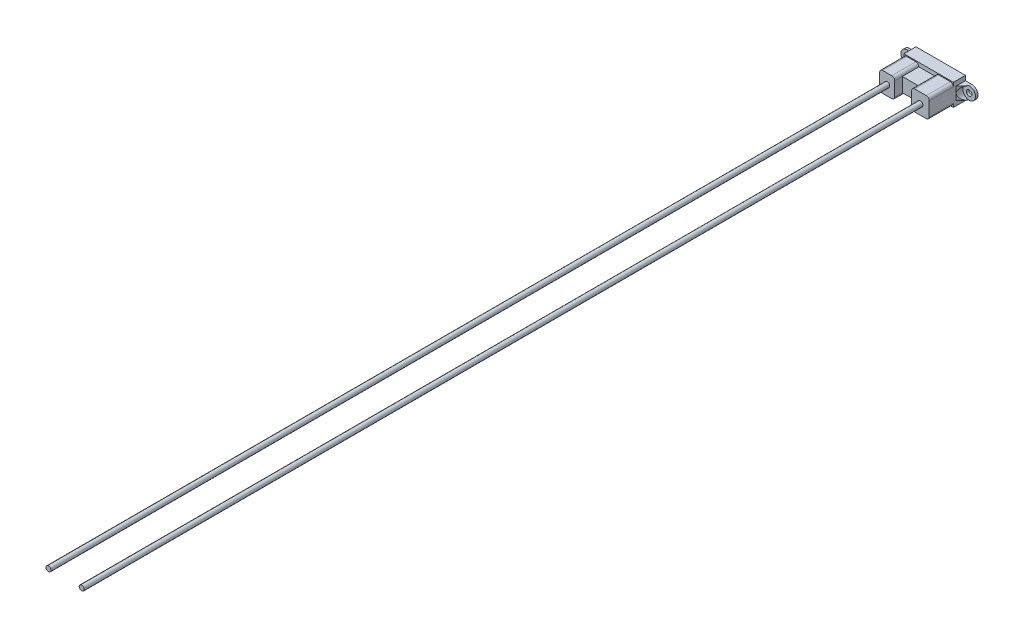
from build123d import *

# Parameters (mm, degrees)
EXTRUDE_1_DEPTH     = 7.2
SKETCH_2_R          = 1.6
EXTRUDE_2_DEPTH     = 1.5
EXTRUDE_START       = -7.5
EXTRUDE_3_DEPTH     = 7.5
EXTRUDE_4_DEPTH     = 10.1
SKETCH_7_R          = 3.75
CUT_EXTRUDE_3_DEPTH = 21.5
SKETCH_8_W          = 10.45
SKETCH_8_H          = 11.9
EXTRUDE_5_DEPTH     = 14.4
FILLET_1_R          = 1.75
EXTRUDE_6_DEPTH     = 9.9
SKETCH_10_W         = 8.1
SKETCH_10_H         = 8.2
EXTRUDE_7_DEPTH     = 5
SKETCH_11_W         = 7.7
SKETCH_11_H         = 4.6
CUT_EXTRUDE_4_DEPTH = 8.2
SKETCH_13_R         = 1.5
EXTRUDE_9_DEPTH     = 500


with BuildPart() as part:
    # 草图1 → 凸台-拉伸1 (new body)
    with BuildSketch(Plane.XY):
        Polygon((14.75, -6.5), (4.675, -6.5), (4.675, -4.2), (-5.425, -4.2), (-5.425, -6.5), (-14.75, -6.5), (-14.75, 6.5), (14.75, 6.5), align=None)
    extrude(amount=EXTRUDE_1_DEPTH)

    # 草图2 → 凸台-拉伸2 (add)
    # profile 1 of 2: a face of its own
    with BuildSketch(Plane.XY):
        with BuildLine():
            Line((-18.5, 3.75), (-14.75, 3.75))
            Line((-14.75, 3.75), (-14.75, -3.75))
            Line((-14.75, -3.75), (-18.5, -3.75))
            ThreePointArc((-18.5, -3.75), (-22.25, 0), (-18.5, 3.75))
        make_face()
        with Locations((-18.5, 0)):
            Circle(SKETCH_2_R, mode=Mode.SUBTRACT)
    # profile 2 of 2: a face of its own
    with BuildSketch(Plane.XY):
        with BuildLine():
            Line((18.5, 3.75), (14.75, 3.75))
            Line((14.75, 3.75), (14.75, 0))
            Line((14.75, 0), (14.75, -3.75))
            Line((14.75, -3.75), (18.5, -3.75))
            ThreePointArc((18.5, -3.75), (22.25, 0), (18.5, 3.75))
        make_face()
        with Locations((18.5, 0)):
            Circle(SKETCH_2_R, mode=Mode.SUBTRACT)
    extrude(amount=EXTRUDE_2_DEPTH)

    # 草图3 → 凸台-拉伸3 (add)
    with BuildSketch(Plane(origin=(0, 3.75, 0), x_dir=(1, 0, 0), z_dir=(0, 1, 0)).offset(EXTRUDE_START)):
        Polygon((-14.75, -1.5), (-14.75, -5.5), (-17.578427125, -2.671572875), (-18.012250402, -1.5), align=None)
    extrude_3 = extrude(amount=EXTRUDE_3_DEPTH)

    # 草图5 → 凸台-拉伸4 (add)
    with BuildSketch(Plane(origin=(-5.425, 0, 0), x_dir=(0, 0, -1), z_dir=(1, 0, 0))):
        Polygon((-3.9, -4.2), (-2.7, -4.2), (-2.7, -6.5), (-2.7, -12.4), (-3.9, -12.4), align=None)
    extrude(amount=EXTRUDE_4_DEPTH)

    # 草图7 → 切除-拉伸3 (cut)
    with BuildSketch(Plane.XY.offset(1.5)):
        with Locations((-18.5, 0)):
            Circle(SKETCH_7_R)
        with BuildLine():
            Line((-18.012250402, 1.523843932), (-18.012250402, -1.523843932))
            ThreePointArc((-18.012250402, -1.523843932), (-20.1, 0), (-18.012250402, 1.523843932))
        make_face(mode=Mode.SUBTRACT)
    cut_extrude_3 = extrude(amount=CUT_EXTRUDE_3_DEPTH, mode=Mode.SUBTRACT)

    # 镜向2: 凸台-拉伸3, 切除-拉伸3 across plane
    add(extrude_3.mirror(Plane(origin=(0, 0, 0), x_dir=(0, 0, 1), z_dir=(1, 0, 0))))
    add(cut_extrude_3.mirror(Plane(origin=(0, 0, 0), x_dir=(0, 0, 1), z_dir=(1, 0, 0))), mode=Mode.SUBTRACT)

    # 草图8 → 凸台-拉伸5 (add)
    with BuildSketch(Plane.XY.offset(7.2)):
        Polygon((-14.75, 0), (-14.75, 5.95), (-5.8, 5.95), (-5.8, -5.95), (-14.75, -5.95), align=None)
        with Locations((9.525, 0)):
            Rectangle(SKETCH_8_W, SKETCH_8_H)
    extrude(amount=EXTRUDE_5_DEPTH)

    # 圆角1
    # the kernel refuses this fillet: 1.75 mm, written as the material it takes off along each edge
    with BuildSketch(Plane(origin=(-14.75, -5.95, 7.2), x_dir=(0, 1, 0), z_dir=(0, 0, 1)), Plane(origin=(14.75, 5.95, 7.2), x_dir=(0, -1, 0), z_dir=(0, 0, 1))) as fillet_1_piece_1:
        with BuildLine():
            CenterArc((FILLET_1_R, -FILLET_1_R), FILLET_1_R, 90, 90)
            Line((0, -FILLET_1_R), (0, 0))
            Line((0, 0), (FILLET_1_R, 0))
        make_face()
    extrude(amount=18.775, mode=Mode.SUBTRACT)
    with BuildSketch(Plane(origin=(-5.8, -5.95, 7.2), x_dir=(0, 1, 0), z_dir=(0, 0, 1)), Plane(origin=(-5.8, 5.95, 7.2), x_dir=(-1, 0, 0), z_dir=(0, 0, 1)), Plane(origin=(-14.75, 5.95, 7.2), x_dir=(0, -1, 0), z_dir=(0, 0, 1)), Plane(origin=(14.75, -5.95, 7.2), x_dir=(0, 1, 0), z_dir=(0, 0, 1)), Plane(origin=(4.3, 5.95, 7.2), x_dir=(0, -1, 0), z_dir=(0, 0, 1)), Plane(origin=(4.3, -5.95, 7.2), x_dir=(1, 0, 0), z_dir=(0, 0, 1))) as fillet_1_piece_2:
        with BuildLine():
            CenterArc((FILLET_1_R, FILLET_1_R), FILLET_1_R, 180, 90)
            Line((0, FILLET_1_R), (0, 0))
            Line((0, 0), (FILLET_1_R, 0))
        make_face()
    extrude(amount=18.775, mode=Mode.SUBTRACT)

    # 草图9 → 凸台-拉伸6 (add)
    with BuildSketch(Plane.XY.offset(7.2)):
        Polygon((-5.8, 0), (-5.8, 4.2), (4.3, 4.2), (4.3, -4.2), (-5.8, -4.2), align=None)
    extrude(amount=EXTRUDE_6_DEPTH)

    # 草图10 → 凸台-拉伸7 (add)
    with BuildSketch(Plane.XY.offset(3.9)):
        with Locations((-0.375, -8.3)):
            Rectangle(SKETCH_10_W, SKETCH_10_H)
    extrude(amount=EXTRUDE_7_DEPTH)

    # 草图11 → 切除-拉伸4 (cut)
    with BuildSketch(Plane.XZ.offset(12.4)):
        with Locations((-0.375, 6.4)):
            Rectangle(SKETCH_11_W, SKETCH_11_H)
    extrude(amount=-CUT_EXTRUDE_4_DEPTH, mode=Mode.SUBTRACT)

    # 草图13 → 凸台-拉伸9 (add)
    with BuildSketch(Plane.XY.offset(21.6)):
        with Locations((-10.275, 0)):
            Circle(SKETCH_13_R)
        with Locations((9.525, 0)):
            Circle(SKETCH_13_R)
    extrude(amount=EXTRUDE_9_DEPTH)


solid = part.part
